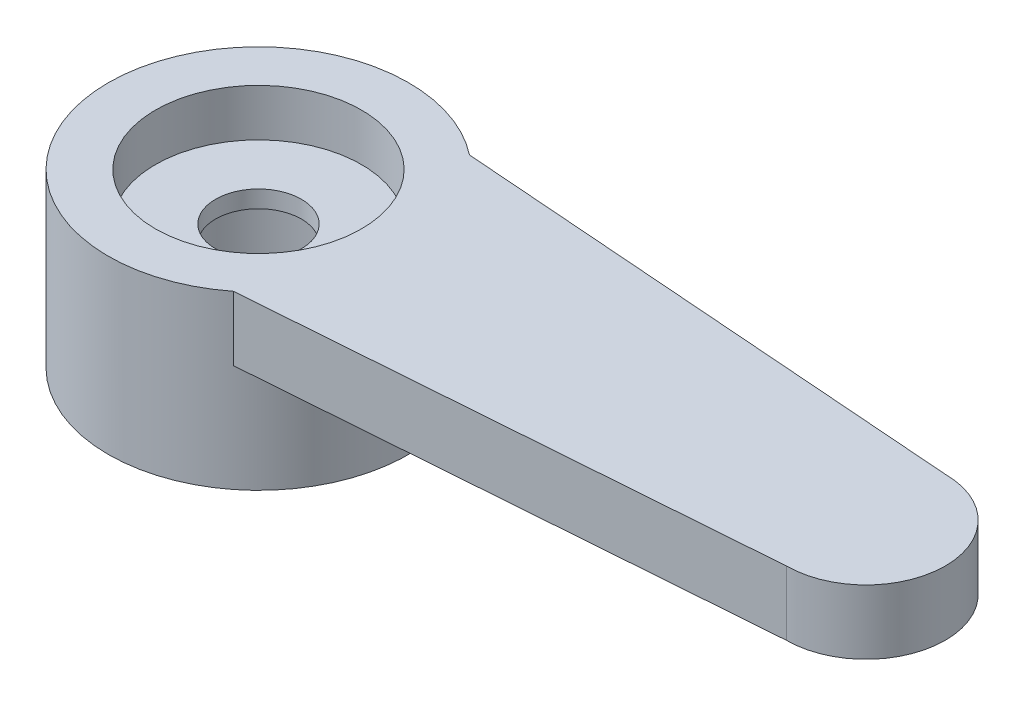
from build123d import *

# Parameters (mm, degrees)
SKETCH_1_R          = 3.5
EXTRUDE_1_DEPTH     = 4
SKETCH_2_R          = 2.4
CUT_EXTRUDE_1_DEPTH = 1.1
SKETCH_3_R          = 1
CUT_EXTRUDE_2_DEPTH = 6.736723804
SKETCH_4_R          = 2.3
CUT_EXTRUDE_3_DEPTH = 2.5
EXTRUDE_START       = -1.5
EXTRUDE_2_DEPTH     = 1.5


with BuildPart() as part:
    # Эскиз1 → Бобышка-Вытянуть1 (new body)
    with BuildSketch(Plane(origin=(0, 0, 0), x_dir=(1, 0, 0), z_dir=(0, 1, 0))):
        Circle(SKETCH_1_R)
    extrude(amount=EXTRUDE_1_DEPTH)

    # Эскиз2 → Вырез-Вытянуть1 (cut)
    with BuildSketch(Plane(origin=(0, 4, 0), x_dir=(1, 0, 0), z_dir=(0, 1, 0))):
        Circle(SKETCH_2_R)
    extrude(amount=-CUT_EXTRUDE_1_DEPTH, mode=Mode.SUBTRACT)

    # Эскиз3 → Вырез-Вытянуть2 (cut, through all)
    with BuildSketch(Plane(origin=(0, 2.9, 0), x_dir=(1, 0, 0), z_dir=(0, 1, 0))):
        Circle(SKETCH_3_R)
    extrude(amount=-CUT_EXTRUDE_2_DEPTH, mode=Mode.SUBTRACT)

    # Эскиз4 → Вырез-Вытянуть3 (cut)
    with BuildSketch(Plane(origin=(0, 0, 0), x_dir=(-1, 0, 0), z_dir=(0, -1, 0))):
        Circle(SKETCH_4_R)
    extrude(amount=-CUT_EXTRUDE_3_DEPTH, mode=Mode.SUBTRACT)

    # Эскиз5 → Бобышка-Вытянуть2 (add)
    with BuildSketch(Plane(origin=(0, 4, 0), x_dir=(1, 0, 0), z_dir=(0, 1, 0)).offset(EXTRUDE_START)):
        with BuildLine():
            Line((14.15, 1.85), (2.165063509, 2.75))
            ThreePointArc((2.165063509, 2.75), (3.5, 0), (2.165063509, -2.75))
            Line((2.165063509, -2.75), (14.15, -1.85))
            ThreePointArc((14.15, -1.85), (16, 0), (14.15, 1.85))
        make_face()
    extrude(amount=EXTRUDE_2_DEPTH)


solid = part.part
